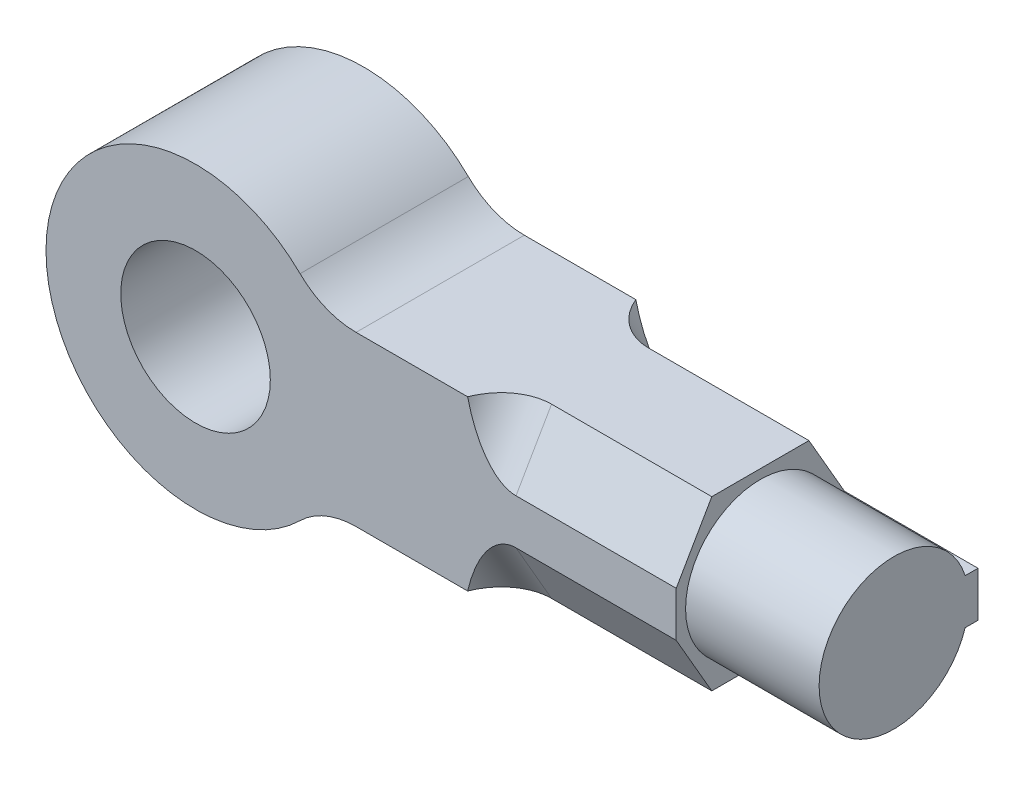
from build123d import *

# Parameters (mm, degrees)
SKETCH1_R                = 56
SKETCH1_R_2              = 28
BOSS_EXTRUDE1_DEPTH      = 31.5
BOSS_EXTRUDE2_REACH      = 246.59
BOSS_EXTRUDE2_END_RADIUS = 56
SKETCH2_W                = 63
SKETCH2_H                = 63
FILLET1_R                = 30
SKETCH3_R                = 28
BOSS_EXTRUDE3_DEPTH      = 50
SKETCH4_R                = 53.440477433
CUT_EXTRUDE1_DEPTH       = 80
FILLET2_R                = 20
BOSS_EXTRUDE4_DEPTH      = 50


with BuildPart() as part:
    # Sketch1 → Boss-Extrude1 (new, symmetric)
    with BuildSketch(Plane.XY):
        Circle(SKETCH1_R)
        Circle(SKETCH1_R_2, mode=Mode.SUBTRACT)
    extrude(amount=BOSS_EXTRUDE1_DEPTH, both=True)

    # Boss-Extrude2: up to this cylinder (the profile starts outside it)
    boss_extrude2_end = Plane(origin=(0, 0, 0), z_dir=(0, 0, -1)) * Cylinder(BOSS_EXTRUDE2_END_RADIUS, 606.18, mode=Mode.PRIVATE)
    # Sketch2 → Boss-Extrude2 (add, up to the surface)
    with BuildSketch(Plane(origin=(180, 0, 0), x_dir=(0, 0, -1), z_dir=(1, 0, 0)), mode=Mode.PRIVATE) as boss_extrude2_sk1:
        Rectangle(SKETCH2_W, SKETCH2_H)
    boss_extrude2_tool1 = extrude(boss_extrude2_sk1.sketch, amount=-BOSS_EXTRUDE2_REACH, mode=Mode.PRIVATE) - boss_extrude2_end
    add(boss_extrude2_tool1.solids().sort_by_distance((180, 0, 0))[0])

    # Fillet1
    fillet1_edges = [part.edges().sort_by_distance(p)[0] for p in [
        (46.300647944, -31.5, 0),
        (46.300647944, 31.5, 0),
    ]]
    fillet(fillet1_edges, radius=FILLET1_R)

    # Sketch3 → Boss-Extrude3 (add)
    with BuildSketch(Plane(origin=(180, 0, 0), x_dir=(0, 0, -1), z_dir=(1, 0, 0))):
        Circle(SKETCH3_R)
    extrude(amount=BOSS_EXTRUDE3_DEPTH)

    # Sketch4 → Cut-Extrude1 (cut)
    with BuildSketch(Plane(origin=(180, 0, 0), x_dir=(0, 0, -1), z_dir=(1, 0, 0))):
        Circle(SKETCH4_R)
        Polygon((18.186533479, -31.5), (36.373066959, 0), (18.186533479, 31.5), (-18.186533479, 31.5), (-36.373066959, 0), (-18.186533479, -31.5), align=None, mode=Mode.SUBTRACT)
    extrude(amount=-CUT_EXTRUDE1_DEPTH, mode=Mode.SUBTRACT)

    # Fillet2
    # the kernel refuses this fillet: 20 mm, written as the material it adds along each edge
    with BuildSketch(Plane(origin=(100, 74.801270189, -6.813466521), x_dir=(1, 0, 0), z_dir=(0, -0.8660254037844388, 0.4999999999999998))) as fillet2_piece_1_section:
        with BuildLine():
            CenterArc((FILLET2_R, FILLET2_R), FILLET2_R, 180, 90)
            Line((0, FILLET2_R), (0, 0))
            Line((0, 0), (FILLET2_R, 0))
        make_face()
    fillet2_piece_1 = extrude(amount=126.626933041, mode=Mode.PRIVATE)
    fillet2_piece_1 = split(fillet2_piece_1, bisect_by=Plane(origin=(105.889651232, 22.332439455, 31.5), z_dir=(0, 0, -1)), keep=Keep.TOP, mode=Mode.PRIVATE)
    fillet2_piece_1 = split(fillet2_piece_1, bisect_by=Plane(origin=(105.889651232, 31.5, 26.207106452), z_dir=(0, -1, 0)), keep=Keep.TOP, mode=Mode.PRIVATE)
    add(fillet2_piece_1)
    with BuildSketch(Plane(origin=(100, 34.860870628, 56.5), x_dir=(0, -0.4999999999999999, 0.8660254037844387), z_dir=(0, -0.8660254037844388, -0.4999999999999999))) as fillet2_piece_2_section:
        with BuildLine():
            CenterArc((FILLET2_R, -FILLET2_R), FILLET2_R, 90, 90)
            Line((0, -FILLET2_R), (0, 0))
            Line((0, 0), (FILLET2_R, 0))
        make_face()
    fillet2_piece_2 = extrude(amount=126.626933041, mode=Mode.PRIVATE)
    fillet2_piece_2 = split(fillet2_piece_2, bisect_by=Plane(origin=(105.889651233, -31.5, 26.207106452), z_dir=(0, 1, 0)), keep=Keep.TOP, mode=Mode.PRIVATE)
    fillet2_piece_2 = split(fillet2_piece_2, bisect_by=Plane(origin=(105.889651233, -22.332439456, 31.5), z_dir=(0, 0, -1)), keep=Keep.TOP, mode=Mode.PRIVATE)
    add(fillet2_piece_2)
    with BuildSketch(Plane(origin=(100, -74.801270189, 6.813466521), x_dir=(0, -0.4999999999999999, -0.8660254037844387), z_dir=(0, 0.8660254037844387, -0.49999999999999994))) as fillet2_piece_3_section:
        with BuildLine():
            CenterArc((FILLET2_R, -FILLET2_R), FILLET2_R, 90, 90)
            Line((0, -FILLET2_R), (0, 0))
            Line((0, 0), (FILLET2_R, 0))
        make_face()
    fillet2_piece_3 = extrude(amount=126.626933041, mode=Mode.PRIVATE)
    fillet2_piece_3 = split(fillet2_piece_3, bisect_by=Plane(origin=(105.889651233, -31.5, -26.207106452), z_dir=(0, 1, 0)), keep=Keep.TOP, mode=Mode.PRIVATE)
    fillet2_piece_3 = split(fillet2_piece_3, bisect_by=Plane(origin=(105.889651233, -22.332439456, -31.5), z_dir=(0, 0, 1)), keep=Keep.TOP, mode=Mode.PRIVATE)
    add(fillet2_piece_3)
    with BuildSketch(Plane(origin=(100, -34.860870628, -56.5), x_dir=(0, 0.49999999999999983, -0.8660254037844387), z_dir=(0, 0.8660254037844388, 0.4999999999999999))) as fillet2_piece_4_section:
        with BuildLine():
            CenterArc((FILLET2_R, -FILLET2_R), FILLET2_R, 90, 90)
            Line((0, -FILLET2_R), (0, 0))
            Line((0, 0), (FILLET2_R, 0))
        make_face()
    fillet2_piece_4 = extrude(amount=126.626933041, mode=Mode.PRIVATE)
    fillet2_piece_4 = split(fillet2_piece_4, bisect_by=Plane(origin=(105.889651233, 22.332439456, -31.5), z_dir=(0, 0, 1)), keep=Keep.TOP, mode=Mode.PRIVATE)
    fillet2_piece_4 = split(fillet2_piece_4, bisect_by=Plane(origin=(105.889651233, 31.5, -26.207106452), z_dir=(0, -1, 0)), keep=Keep.TOP, mode=Mode.PRIVATE)
    add(fillet2_piece_4)

    # Sketch5 → Boss-Extrude4 (add)
    with BuildSketch(Plane(origin=(180, 0, 0), x_dir=(0, 0, -1), z_dir=(1, 0, 0))):
        with BuildLine():
            Line((31.5, 8.440399562), (26.697558975, 8.440399562))
            ThreePointArc((26.697558975, 8.440399562), (28, 0), (26.697558975, -8.440399562))
            Line((26.697558975, -8.440399562), (31.5, -8.440399562))
            Line((31.5, -8.440399562), (31.5, 8.440399562))
        make_face()
    extrude(amount=BOSS_EXTRUDE4_DEPTH)


solid = part.part
